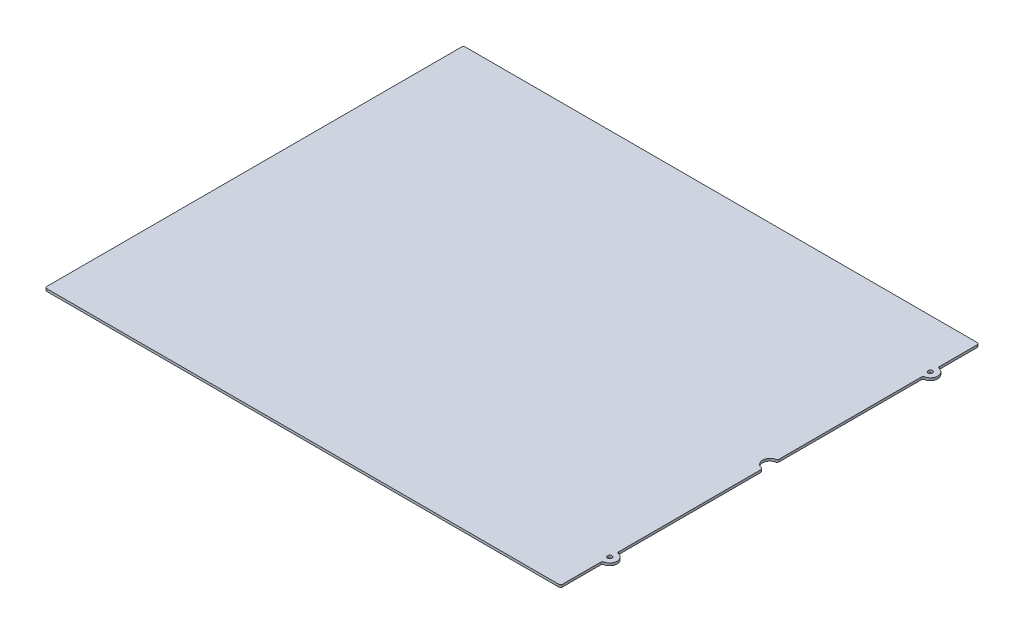
from build123d import *

# Parameters (mm, degrees)
BOSS_EXTRUDE1_DEPTH        = 3.175
F_1_0_228_DIAMETER_HOLE1_D = 5.7912
FILLET1_R                  = 2.54


with BuildPart() as part:
    # Sketch1 → Boss-Extrude1 (new body)
    with BuildSketch(Plane(origin=(0, 0, 0), x_dir=(1, 0, 0), z_dir=(0, 1, 0))):
        with BuildLine():
            Line((337.058, 219.456), (337.058, 273.558))
            Line((337.058, 273.558), (-337.058, 273.558))
            Line((-337.058, 273.558), (-337.058, -273.558))
            Line((-337.058, -273.558), (337.058, -273.558))
            Line((337.058, -273.558), (337.058, -218.948))
            ThreePointArc((337.058, -218.948), (346.71, -209.296), (337.058, -199.644))
            Line((337.058, -199.644), (337.058, -9.398))
            ThreePointArc((337.058, -9.398), (327.406, 0.254), (337.058, 9.906))
            Line((337.058, 9.906), (337.058, 200.152))
            ThreePointArc((337.058, 200.152), (346.71, 209.804), (337.058, 219.456))
        make_face()
    extrude(amount=BOSS_EXTRUDE1_DEPTH)

    # #1 (0.228) Diameter Hole1 (through all)
    with Locations(Plane(origin=(0, 3.175, 0), x_dir=(1, 0, 0), z_dir=(0, 1, 0))):
        with Locations((337.058, 209.804), (337.058, -209.296)):
            Hole(F_1_0_228_DIAMETER_HOLE1_D / 2)

    # Fillet1
    fillet1_edges = [part.edges().sort_by_distance(p)[0] for p in [
        (-337.058, 1.5875, -273.558),
        (-337.058, 1.5875, 273.558),
        (337.058, 1.5875, 273.558),
        (337.058, 1.5875, 218.948),
        (337.058, 1.5875, 199.644),
        (337.058, 1.5875, 9.398),
        (337.058, 1.5875, -9.906),
        (337.058, 1.5875, -200.152),
        (337.058, 1.5875, -273.558),
        (337.058, 1.5875, -219.456),
    ]]
    fillet(fillet1_edges, radius=FILLET1_R)


solid = part.part
